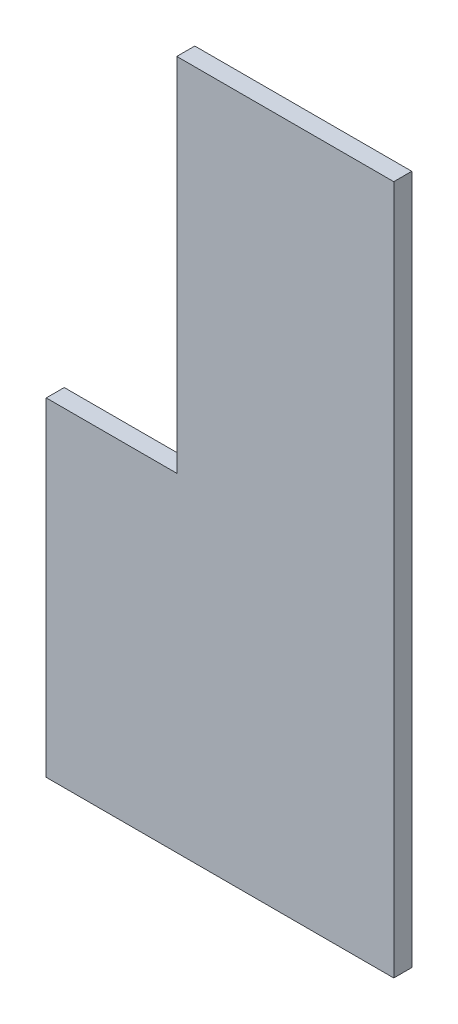
from build123d import *

# Parameters (mm, degrees)
TABAN_FLAN_1_DEPTH = 20


# Sheet-metal steps are written as plain solids
with BuildPart() as part:
    # Çizim1 → Taban-Flanş1 (new body)
    with BuildSketch(Plane.XY):
        Polygon((0, 0), (0, 365), (145, 365), (145, 766), (386, 766), (386, 0), align=None)
    extrude(amount=-TABAN_FLAN_1_DEPTH)


solid = part.part
